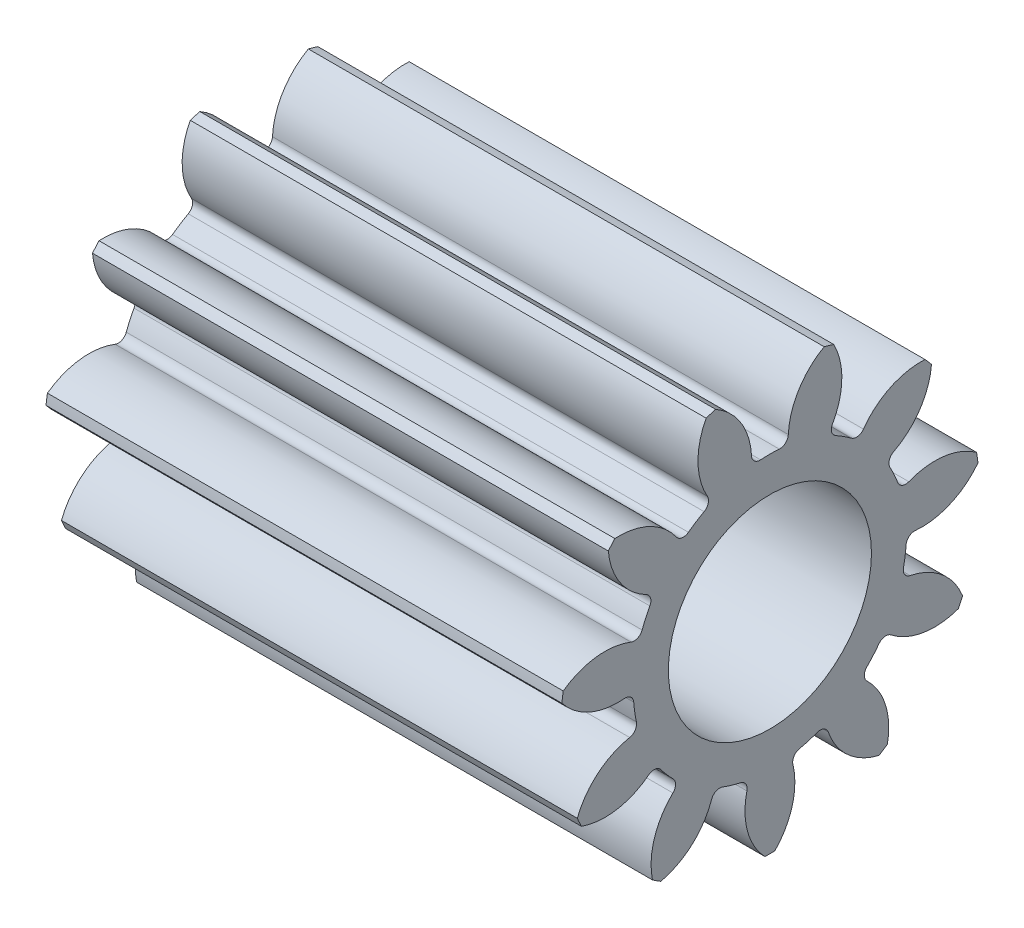
from build123d import *

# Parameters (mm, degrees)
BASPROSKE_W                = 12.7
BASPROSKE_H                = 5.159375
TOOTHCUT_DEPTH             = 15.646784657
ROOTFILLETS_R              = 0.20955
TEETHCUTS_COUNT            = 11
TEETHCUTS_ANGLE            = 327.272727273
ROOTFILLETS_OF_TEETHCUTS_R = 0.20955
CUT_EXTRUDE1_REACH         = 16.634
SKETCH1_R                  = 2.499999953


with BuildPart() as part:
    # BasProSke → Base-Revolve (revolve)
    with BuildSketch(Plane(origin=(0, 0, 0), x_dir=(1, 0, 0), z_dir=(0, 1, 0))):
        with Locations((6.35, 2.5796875)):
            Rectangle(BASPROSKE_W, BASPROSKE_H)
    revolve(axis=Axis((-10, 0, 0), (1, 0, 0)))

    # TooCutSke → ToothCut (cut, through all)
    with BuildSketch(Plane(origin=(0, 0, 0), x_dir=(0, 0, -1), z_dir=(1, 0, 0))):
        with BuildLine():
            ThreePointArc((0.455692995, 3.331302043), (0, 3.362325), (-0.455692995, 3.331302043))
            ThreePointArc((-0.455692995, 3.331302043), (-0.66414347, 4.301321709), (-1.3673759, 5.001217347))
            ThreePointArc((-1.3673759, 5.001217347), (0, 5.184775), (1.3673759, 5.001217347))
            ThreePointArc((1.3673759, 5.001217347), (0.66414347, 4.301321709), (0.455692995, 3.331302043))
        make_face()
    toothcut = extrude(amount=TOOTHCUT_DEPTH, mode=Mode.SUBTRACT)

    # RootFillets
    rootfillets_edges = [part.edges().sort_by_distance(p)[0] for p in [
        (6.35, 3.331302043, -0.455692995),
        (6.35, 3.331302043, 0.455692995),
    ]]
    fillet(rootfillets_edges, radius=ROOTFILLETS_R)

    # TeethCuts: ToothCut ×11 about axis
    teethcuts_axis = Axis((-10, 0, 0), (1, 0, 0))
    for i in range(1, TEETHCUTS_COUNT):
        add(toothcut.rotate(teethcuts_axis, i * TEETHCUTS_ANGLE / (TEETHCUTS_COUNT - 1)), mode=Mode.SUBTRACT)

    # RootFillets of TeethCuts
    rootfillets_of_teethcuts_edges = [part.edges().sort_by_distance(p)[0] for p in [
        (6.35, 3.048835846, 1.417684518),
        (6.35, 2.556103379, 2.184391201),
        (6.35, 1.798385809, 2.840957213),
        (6.35, 0.969359954, 3.219560636),
        (6.35, -0.023039015, 3.362246066),
        (6.35, -0.925148408, 3.232542317),
        (6.35, -1.837149114, 2.81604555),
        (6.35, -2.525928687, 2.219214652),
        (6.35, -3.067977351, 1.375770469),
        (6.35, -3.324744456, 0.501302016),
        (6.35, -3.324744456, -0.501302016),
        (6.35, -3.067977351, -1.375770469),
        (6.35, -2.525928687, -2.219214652),
        (6.35, -1.837149114, -2.81604555),
        (6.35, -0.925148408, -3.232542317),
        (6.35, -0.023039015, -3.362246066),
        (6.35, 0.969359954, -3.219560636),
        (6.35, 1.798385809, -2.840957213),
        (6.35, 2.556103379, -2.184391201),
        (6.35, 3.048835846, -1.417684518),
    ]]
    fillet(rootfillets_of_teethcuts_edges, radius=ROOTFILLETS_OF_TEETHCUTS_R)

    # Sketch1 → Cut-Extrude1 (cut, up to next)
    with BuildSketch(Plane(origin=(12.7, 0, 0), x_dir=(0, 0, -1), z_dir=(1, 0, 0)), mode=Mode.PRIVATE) as cut_extrude1_sk1:
        Circle(SKETCH1_R)
    cut_extrude1_tool1 = extrude(cut_extrude1_sk1.sketch, amount=-CUT_EXTRUDE1_REACH, mode=Mode.PRIVATE) & part.part
    add(cut_extrude1_tool1.solids().sort_by_distance((12.7, 0, 0))[0], mode=Mode.SUBTRACT)


solid = part.part
